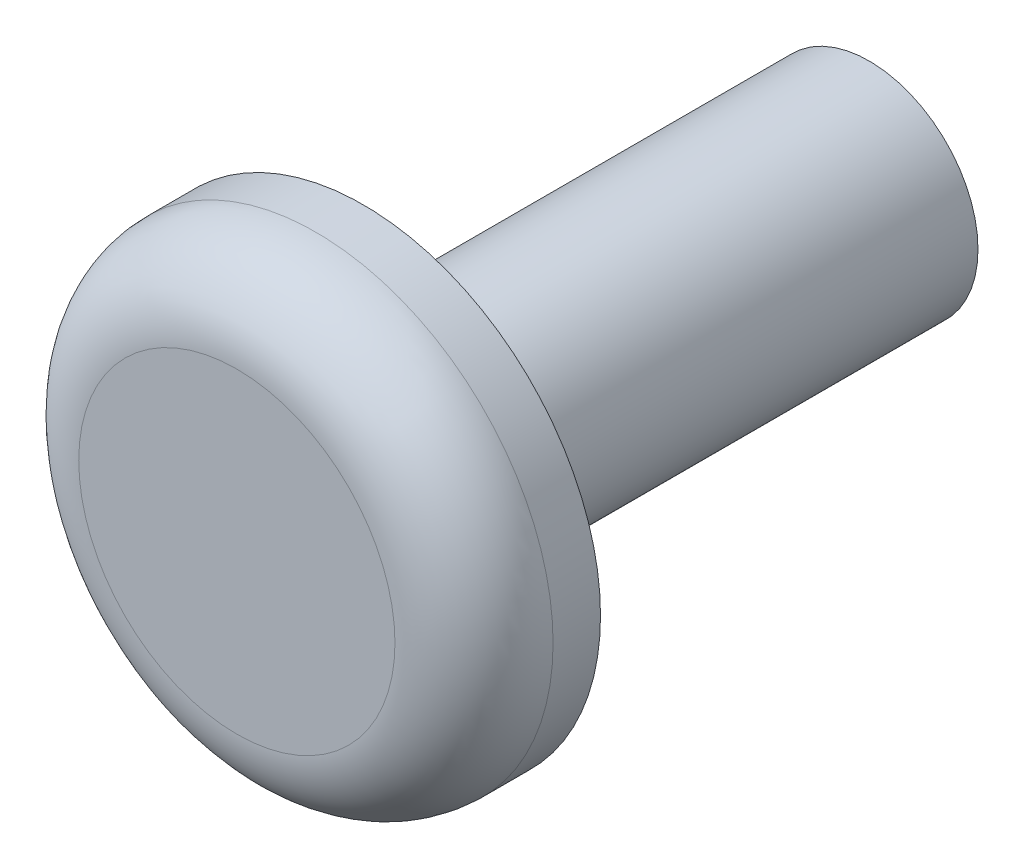
from build123d import *

# Parameters (mm, degrees)
SKETCH1_R           = 3.4375
BOSS_EXTRUDE1_DEPTH = 16
SKETCH2_R           = 7.5
BOSS_EXTRUDE2_DEPTH = 4
SKETCH3_R           = 1.5
CUT_EXTRUDE1_DEPTH  = 5
CHAMFER1_SIZE       = 0.2
CHAMFER1_SIZE2      = 1
FILLET1_R           = 2.5


with BuildPart() as part:
    # Sketch1 → Boss-Extrude1 (new body)
    with BuildSketch(Plane.XY):
        Circle(SKETCH1_R)
    extrude(amount=BOSS_EXTRUDE1_DEPTH)

    # Sketch2 → Boss-Extrude2 (add)
    with BuildSketch(Plane.XY.offset(16)):
        Circle(SKETCH2_R)
    extrude(amount=BOSS_EXTRUDE2_DEPTH)

    # Sketch3 → Cut-Extrude1 (cut)
    with BuildSketch(Plane(origin=(0, 0, 0), x_dir=(-1, 0, 0), z_dir=(0, 0, -1))):
        Circle(SKETCH3_R)
    extrude(amount=-CUT_EXTRUDE1_DEPTH, mode=Mode.SUBTRACT)

    # Chamfer1
    chamfer1_edges = [part.edges().sort_by_distance(p)[0] for p in [
        (1.5, 0, 0),
    ]]
    chamfer1_side = [part.faces().sort_by_distance(p)[0] for p in [
        (-3.340272818, 0, 0),
    ]]
    chamfer(chamfer1_edges, length=CHAMFER1_SIZE, length2=CHAMFER1_SIZE2, reference=chamfer1_side[0])

    # Fillet1
    fillet1_edges = [part.edges().sort_by_distance(p)[0] for p in [
        (-7.5, 0, 20),
    ]]
    fillet(fillet1_edges, radius=FILLET1_R)


solid = part.part
